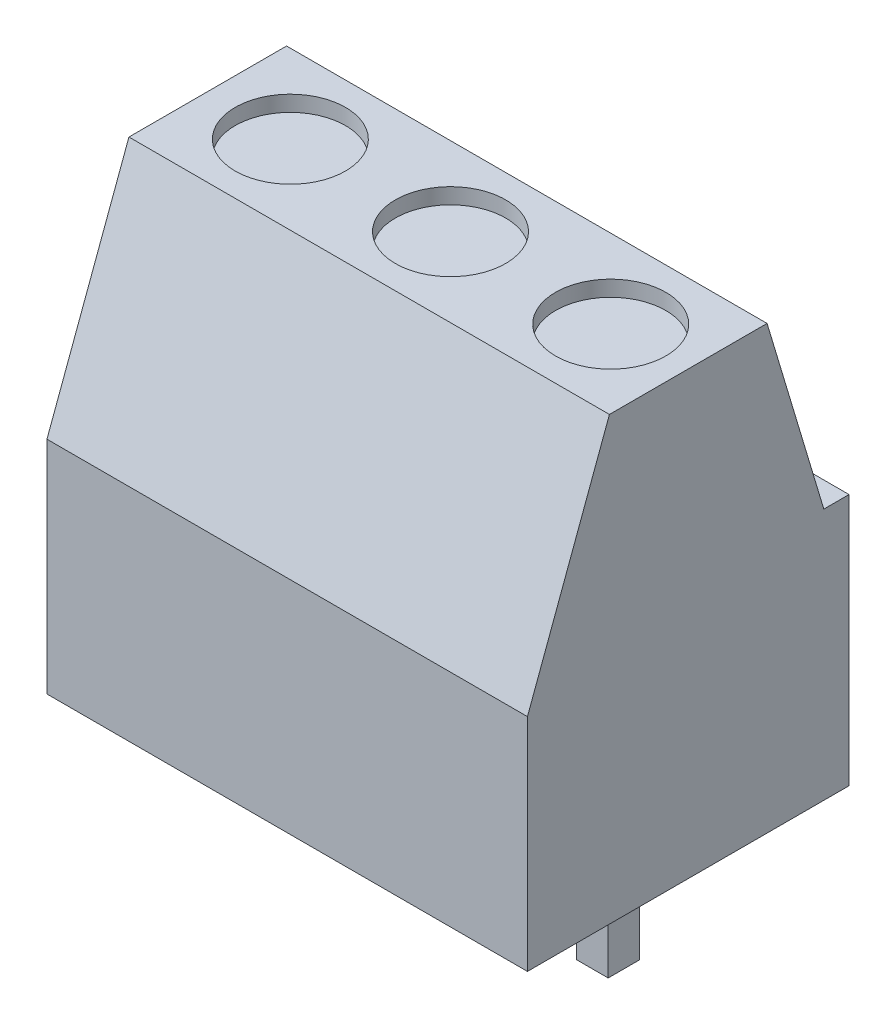
from build123d import *

# Parameters (mm, degrees)
SKETCH3_W             = 15.24
SKETCH3_H             = 10.2
BOSS_EXTRUDE3_DEPTH   = 14
CUT_EXTRUDE1_DEPTH    = 22.313554373
SKETCH5_R             = 1.75
CUT_EXTRUDE2_DEPTH    = 0.5
SKETCH6_W             = 2.6
SKETCH6_H             = 3
CUT_EXTRUDE4_DEPTH    = 0.5
SKETCH7_W             = 1
SKETCH7_H             = 1
BOSS_EXTRUDE4_DEPTH   = 3.5
LPATTERN2_START       = 4.58
LPATTERN2_OUTLINE_W   = 3.5
LPATTERN2_OUTLINE_H   = 1
LPATTERN2_DEPTH       = 1
LPATTERN2_START_2     = -0.5
LPATTERN2_2_OUTLINE_W = 3.5
LPATTERN2_2_OUTLINE_H = 1
LPATTERN2_2_DEPTH     = 1
LPATTERN2_START_3     = 13.5
LPATTERN2_3_OUTLINE_R = 1.75
LPATTERN2_3_DEPTH     = 0.5
LPATTERN2_START_4     = 2
LPATTERN2_4_OUTLINE_W = 2.6
LPATTERN2_4_OUTLINE_H = 0.5
LPATTERN2_4_DEPTH     = 3


# Read off the part's stored shape, not the designer's step: LPattern2
with BuildPart() as part:
    # Sketch3 → Boss-Extrude3 (new body)
    with BuildSketch(Plane(origin=(0, 0, 0), x_dir=(1, 0, 0), z_dir=(0, 1, 0))):
        Rectangle(SKETCH3_W, SKETCH3_H)
    extrude(amount=BOSS_EXTRUDE3_DEPTH)

    # Sketch4 → Cut-Extrude1 (cut, through all)
    with BuildSketch(Plane.ZY.offset(7.62)):
        Polygon((-4.3, 8), (-2.5, 14), (-4.3, 14), (-5.1, 14), (-5.1, 8), align=None)
        Polygon((5.1, 14), (2.5, 14), (5.1, 7), align=None)
    extrude(amount=-CUT_EXTRUDE1_DEPTH, mode=Mode.SUBTRACT)

    # Sketch5 → Cut-Extrude2 (cut)
    with BuildSketch(Plane(origin=(0, 14, 0), x_dir=(1, 0, 0), z_dir=(0, 1, 0))):
        with Locations(Location((-5, 0, 0), (0, 0, 270))):
            Circle(SKETCH5_R)
    extrude(amount=-CUT_EXTRUDE2_DEPTH, mode=Mode.SUBTRACT)

    # Sketch6 → Cut-Extrude4 (cut)
    with BuildSketch(Plane(origin=(0, 0, -5.1), x_dir=(-1, 0, 0), z_dir=(0, 0, -1))):
        with Locations((5.08, 3.5)):
            Rectangle(SKETCH6_W, SKETCH6_H)
    extrude(amount=-CUT_EXTRUDE4_DEPTH, mode=Mode.SUBTRACT)

    # LPattern2 3 outline → LPattern2 3 (cut)
    with BuildSketch(Plane(origin=(0, 0, 0), x_dir=(1, 0, 0), z_dir=(0, 1, 0)).offset(LPATTERN2_START_3)):
        with Locations((5.16, 0)):
            Circle(LPATTERN2_3_OUTLINE_R)
        with Locations((0.08, 0)):
            Circle(LPATTERN2_3_OUTLINE_R)
    extrude(amount=LPATTERN2_3_DEPTH, mode=Mode.SUBTRACT)

    # LPattern2 4 outline → LPattern2 4 (cut)
    with BuildSketch(Plane(origin=(0, 0, 0), x_dir=(1, 0, 0), z_dir=(0, 1, 0)).offset(LPATTERN2_START_4)):
        with Locations((0, 4.85)):
            Rectangle(LPATTERN2_4_OUTLINE_W, LPATTERN2_4_OUTLINE_H)
        with Locations((5.08, 4.85)):
            Rectangle(LPATTERN2_4_OUTLINE_W, LPATTERN2_4_OUTLINE_H)
    extrude(amount=LPATTERN2_4_DEPTH, mode=Mode.SUBTRACT)


with BuildPart() as body_2:
    # Sketch7 → Boss-Extrude4 (new body)
    with BuildSketch(Plane.XZ):
        with Locations((-5.08, 0)):
            Rectangle(SKETCH7_W, SKETCH7_H)
    extrude(amount=BOSS_EXTRUDE4_DEPTH)


with BuildPart() as body_3:
    # LPattern2 outline → LPattern2 (new body)
    with BuildSketch(Plane.YZ.offset(LPATTERN2_START)):
        with Locations((-1.75, 0)):
            Rectangle(LPATTERN2_OUTLINE_W, LPATTERN2_OUTLINE_H)
    extrude(amount=LPATTERN2_DEPTH)


with BuildPart() as body_4:
    # LPattern2 2 outline → LPattern2 2 (new body)
    with BuildSketch(Plane.YZ.offset(LPATTERN2_START_2)):
        with Locations((-1.75, 0)):
            Rectangle(LPATTERN2_2_OUTLINE_W, LPATTERN2_2_OUTLINE_H)
    extrude(amount=LPATTERN2_2_DEPTH)


solid = Compound([part.part, body_2.part, body_3.part, body_4.part])
